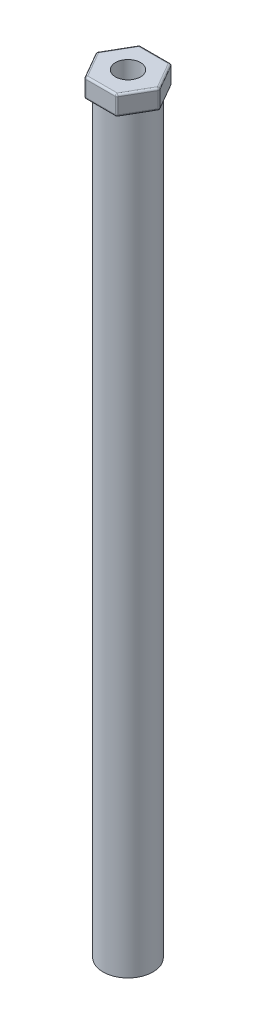
from build123d import *

# Parameters (mm, degrees)
SKETCH1_R           = 6.35
SKETCH1_R_2         = 3.175
BOSS_EXTRUDE1_DEPTH = 190.5
SKETCH2_R           = 3.175
BOSS_EXTRUDE2_DEPTH = 5
FILLET1_R           = 0.5


with BuildPart() as part:
    # Sketch1 → Boss-Extrude1 (new body)
    with BuildSketch(Plane(origin=(0, 0, 0), x_dir=(1, 0, 0), z_dir=(0, 1, 0))):
        Circle(SKETCH1_R)
        Circle(SKETCH1_R_2, mode=Mode.SUBTRACT)
    extrude(amount=BOSS_EXTRUDE1_DEPTH)

    # Sketch2 → Boss-Extrude2 (add)
    with BuildSketch(Plane(origin=(0, 190.5, 0), x_dir=(1, 0, 0), z_dir=(0, 1, 0))):
        Polygon((-8.065583261, 0), (-4.03279163, -6.985), (4.03279163, -6.985), (8.065583261, 0), (4.03279163, 6.985), (-4.03279163, 6.985), align=None)
        Circle(SKETCH2_R, mode=Mode.SUBTRACT)
    extrude(amount=BOSS_EXTRUDE2_DEPTH)

    # Fillet1
    fillet1_edges = [part.edges().sort_by_distance(p)[0] for p in [
        (6.049187445, 190.5, -3.4925),
        (4.03279163, 193, -6.985),
        (8.065583261, 193, 0),
        (-4.03279163, 193, -6.985),
        (-6.049187445, 190.5, -3.4925),
        (-8.065583261, 193, 0),
        (-6.049187445, 190.5, 3.4925),
        (-4.03279163, 193, 6.985),
        (0, 190.5, 6.985),
        (6.049187445, 190.5, 3.4925),
        (4.03279163, 193, 6.985),
        (6.049187445, 195.5, 3.4925),
        (6.049187445, 195.5, -3.4925),
        (0, 195.5, -6.985),
        (-6.049187445, 195.5, -3.4925),
        (-6.049187445, 195.5, 3.4925),
        (0, 195.5, 6.985),
        (0, 190.5, -6.985),
    ]]
    fillet(fillet1_edges, radius=FILLET1_R)


solid = part.part
